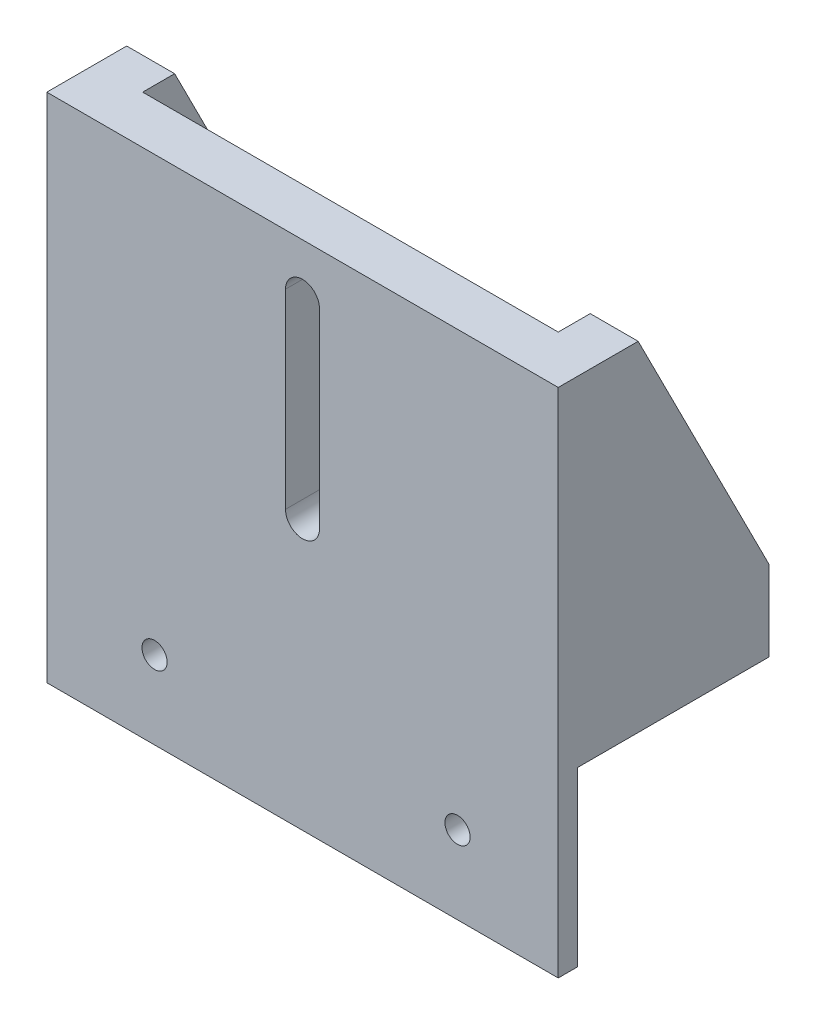
from build123d import *

# Parameters (mm, degrees)
SKETCH1_W                                           = 101.6
SKETCH1_H                                           = 101.6
BOSS_EXTRUDE1_DEPTH                                 = 3.81
M6X1_0_TAPPED_HOLE1_D                               = 5
M6X1_0_TAPPED_HOLE1_DEPTH                           = 14.986
M6X1_0_TAPPED_HOLE1_TIP                             = 1.502151548
SKETCH4_W                                           = 101.6
SKETCH4_H                                           = 67.31
BOSS_EXTRUDE2_DEPTH                                 = 5.715
SKETCH7_W                                           = 101.6
SKETCH7_H                                           = 9.525
BOSS_EXTRUDE3_DEPTH                                 = 32.385
DZ_START                                            = -5.715
DZ_SLOT_DEPTH                                       = 9.525
RIB_1_BOSS_EXTRUDE4_DEPTH                           = 9.525
RIB_2_BOSS_EXTRUDE5_DEPTH                           = 9.525
CSK_FOR_1_4_FLAT_HEAD_SOCKET_CAP_SCREW1_D           = 6.7564
CSK_FOR_1_4_FLAT_HEAD_SOCKET_CAP_SCREW1_CSINK_D     = 13.4874
CSK_FOR_1_4_FLAT_HEAD_SOCKET_CAP_SCREW1_CSINK_ANGLE = 82


# Read off the part's stored shape, not the designer's step: dz slot
with BuildPart() as part:
    # Sketch1 → Boss-Extrude1 (new body)
    with BuildSketch(Plane.XY):
        with Locations((-50.8, 88.9)):
            Rectangle(SKETCH1_W, SKETCH1_H)
    extrude(amount=BOSS_EXTRUDE1_DEPTH)

    # M6x1.0 Tapped Hole1
    with Locations(Plane(origin=(-50.8, 0, 0), x_dir=(-1, 0, 0), z_dir=(0, 0, -1))):
        with Locations((-30.795161674, 53.586240129), (29.387245779, 53.586240129)):
            Hole(M6X1_0_TAPPED_HOLE1_D / 2, depth=M6X1_0_TAPPED_HOLE1_DEPTH)
            with Locations((0, 0, -(M6X1_0_TAPPED_HOLE1_DEPTH + M6X1_0_TAPPED_HOLE1_TIP / 2))):  # 118° drill point
                Cone(0, M6X1_0_TAPPED_HOLE1_D / 2, M6X1_0_TAPPED_HOLE1_TIP, mode=Mode.SUBTRACT)

    # Sketch4 → Boss-Extrude2 (add)
    with BuildSketch(Plane(origin=(0, 0, 0), x_dir=(-1, 0, 0), z_dir=(0, 0, -1))):
        with Locations((50.8, 106.045)):
            Rectangle(SKETCH4_W, SKETCH4_H)
    extrude(amount=BOSS_EXTRUDE2_DEPTH)

    # Sketch7 → Boss-Extrude3 (add)
    with BuildSketch(Plane(origin=(0, 0, -5.715), x_dir=(-1, 0, 0), z_dir=(0, 0, -1))):
        with Locations((50.8, 77.1525)):
            Rectangle(SKETCH7_W, SKETCH7_H)
    extrude(amount=BOSS_EXTRUDE3_DEPTH)

    # dz slot outline → dz slot (cut)
    with BuildSketch(Plane.XY.offset(DZ_START)):
        with BuildLine():
            ThreePointArc((-47.4218, 129.5146), (-50.8, 132.8928), (-54.1782, 129.5146))
            Line((-54.1782, 129.5146), (-54.1782, 91.6432))
            ThreePointArc((-54.1782, 91.6432), (-50.8, 88.265), (-47.4218, 91.6432))
            Line((-47.4218, 91.6432), (-47.4218, 129.5146))
        make_face()
    extrude(amount=DZ_SLOT_DEPTH, mode=Mode.SUBTRACT)

    # rib 1 Sketch9 → rib 1 Boss-Extrude4 (add)
    with BuildSketch(Plane(origin=(0, 0, 0), x_dir=(0, 0, -1), z_dir=(1, 0, 0))):
        Polygon((38.1, 81.915), (38.1, 88.265), (12.065, 139.7), (5.715, 139.7), (5.715, 81.915), align=None)
    extrude(amount=-RIB_1_BOSS_EXTRUDE4_DEPTH)

    # Sketch10 → rib 2 Boss-Extrude5 (add)
    with BuildSketch(Plane.ZY.offset(101.6)):
        Polygon((-38.1, 81.915), (-5.715, 81.915), (-5.715, 139.7), (-12.065, 139.7), (-38.1, 88.265), align=None)
    extrude(amount=-RIB_2_BOSS_EXTRUDE5_DEPTH)

    # CSK for 1/4 Flat Head Socket Cap Screw1 (through all)
    with Locations(Plane(origin=(-50.8, 81.915, -38.1), x_dir=(1, 0, 0), z_dir=(0, 1, 0))):
        with Locations((19.05, -19.05), (-19.05, -19.05)):
            CounterSinkHole(CSK_FOR_1_4_FLAT_HEAD_SOCKET_CAP_SCREW1_D / 2, CSK_FOR_1_4_FLAT_HEAD_SOCKET_CAP_SCREW1_CSINK_D / 2, counter_sink_angle=CSK_FOR_1_4_FLAT_HEAD_SOCKET_CAP_SCREW1_CSINK_ANGLE)


solid = part.part
